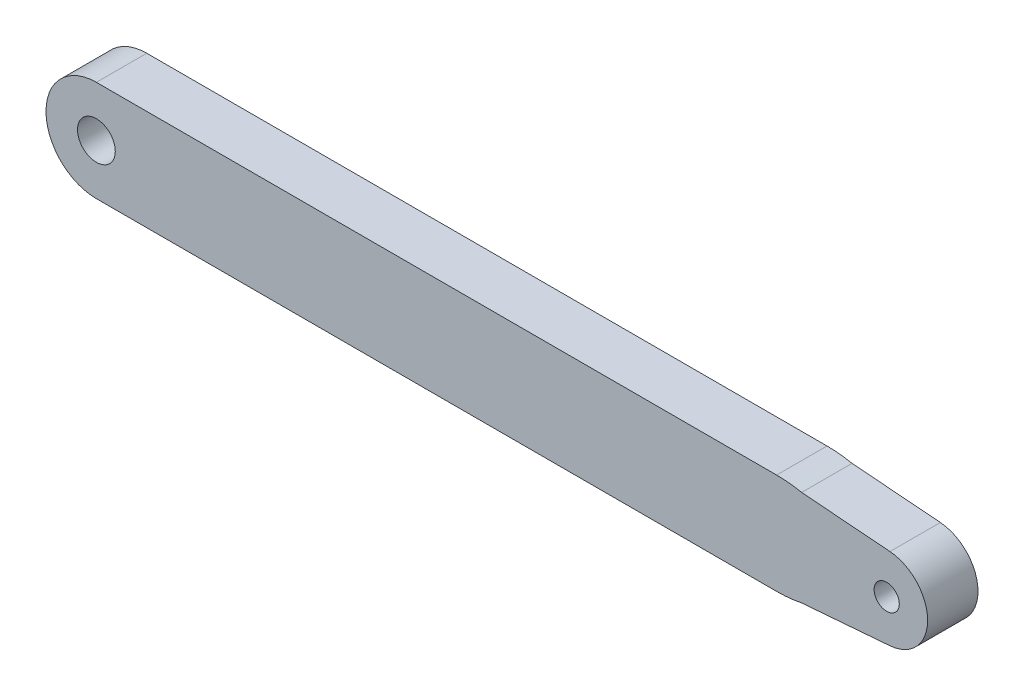
from build123d import *

# Parameters (mm, degrees)
SKETCH1_W           = 350
SKETCH1_H           = 40
BOSS_EXTRUDE1_DEPTH = 20
CUT_EXTRUDE1_DEPTH  = 178.270979012
FILLET1_R           = 50
FILLET2_R           = 50
FILLET3_R           = 16.247923
FILLET4_RADIUS      = 20
FILLET4_LENGTH      = 20
SKETCH3_R           = 7.5
SKETCH3_R_2         = 5
CUT_EXTRUDE2_DEPTH  = 178.270979012


with BuildPart() as part:
    # Sketch1 → Boss-Extrude1 (new body)
    with BuildSketch(Plane.XY):
        Rectangle(SKETCH1_W, SKETCH1_H)
    extrude(amount=BOSS_EXTRUDE1_DEPTH)

    # Sketch2 → Cut-Extrude1 (cut, through all)
    with BuildSketch(Plane.XY.offset(20)):
        Polygon((175, 20), (175, 15), (125, 19), (125, 20), align=None)
    cut_extrude1 = extrude(amount=-CUT_EXTRUDE1_DEPTH, mode=Mode.SUBTRACT)

    # Fillet1
    # the kernel refuses this fillet: 50 mm, written as the material it takes off along each edge
    with BuildSketch(Plane(origin=(125, 20, 44.874685928), x_dir=(-1, 0, 0), z_dir=(0, 0, -1))) as fillet1_piece_1:
        with BuildLine():
            CenterArc((9.949874371, -50), FILLET1_R, 90, 11.478340955)
            Line((0, -1), (-0.198997487, -0.02))
            ThreePointArc((-0.198997487, -0.02), (-1, -0.5), (-1, 0))
            Line((-1, 0), (0, 1))
            Line((0, 1), (9.949874371, 1))
            Line((9.949874371, 1), (9.949874371, 0))
        make_face()
    extrude(amount=69.749371855, mode=Mode.SUBTRACT)

    # Mirror3: Cut-Extrude1 across plane
    add(cut_extrude1.mirror(Plane.ZX), mode=Mode.SUBTRACT)

    # Fillet2
    # the kernel refuses this fillet: 50 mm, written as the material it takes off along each edge
    with BuildSketch(Plane(origin=(125, -20, 44.874685928), x_dir=(0, 1, 0), z_dir=(0, 0, -1))) as fillet2_piece_1:
        with BuildLine():
            CenterArc((50, -9.949874371), FILLET2_R, 168.521659045, 11.478340955)
            Line((0, -9.949874371), (-1, -9.949874371))
            Line((-1, -9.949874371), (-1, 0))
            Line((-1, 0), (0, 1))
            ThreePointArc((0, 1), (0.5, 1), (0.02, 0.198997487))
            Line((0.02, 0.198997487), (1, 0))
        make_face()
    extrude(amount=69.749371855, mode=Mode.SUBTRACT)

    # Fillet3
    fillet3_edges = [part.edges().sort_by_distance(p)[0] for p in [
        (175, 15, 10),
        (175, -15, 10),
    ]]
    fillet(fillet3_edges, radius=FILLET3_R)

    # Fillet4: full round fillet: the end face becomes a half cylinder, R = half its width
    fillet4_face = Plane((-175, 0, 10), x_dir=(0, 0, 1), z_dir=(-1, 0, 0))  # on the end face: x along it, z out of the body
    fillet4_slab = fillet4_face.offset(-FILLET4_RADIUS / 2) * Box(FILLET4_LENGTH, 2 * FILLET4_RADIUS, FILLET4_RADIUS, mode=Mode.PRIVATE)  # the body's end, R deep
    fillet4_round = Plane((-155, 0, 10), x_dir=(-1, 0, 0), z_dir=(0, 0, 1)) * Cylinder(FILLET4_RADIUS, FILLET4_LENGTH, mode=Mode.PRIVATE)  # its axis R under the face
    add(fillet4_slab - fillet4_round, mode=Mode.SUBTRACT)

    # Sketch3 → Cut-Extrude2 (cut, through all)
    with BuildSketch(Plane.XY.offset(20)):
        with Locations((-155, 0)):
            Circle(SKETCH3_R)
        with Locations((158.752076555, 0)):
            Circle(SKETCH3_R_2)
    extrude(amount=-CUT_EXTRUDE2_DEPTH, mode=Mode.SUBTRACT)


solid = part.part
